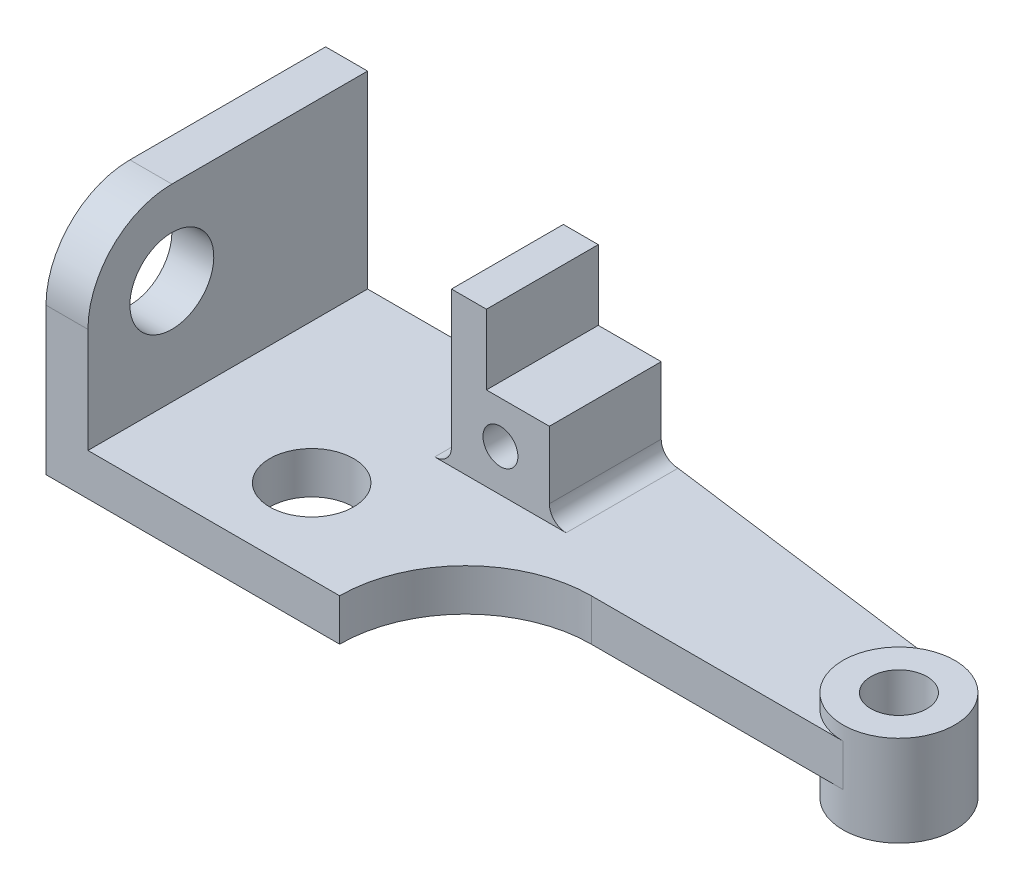
from build123d import *

# Parameters (mm, degrees)
SKETCH1_R               = 3.96875
BOSS_EXTRUDE1_DEPTH     = 9.525
BOSS_EXTRUDE4_START     = 9.525
BOSS_EXTRUDE4_OUTLINE_R = 3.96875
BOSS_EXTRUDE4_DEPTH     = 15.875
BOSS_EXTRUDE5_START     = 25.4
BOSS_EXTRUDE5_DEPTH     = 38.1
SKETCH4_R               = 9.525
CUT_EXTRUDE1_DEPTH      = 177.01216089
SKETCH2_R               = 9.525
SKETCH2_W               = 12.7
SKETCH2_H               = 28.575
CUT_EXTRUDE2_DEPTH      = 182.288051609
CUT_EXTRUDE3_DEPTH      = 3.175
CUT_EXTRUDE4_START      = -12.7
CUT_EXTRUDE4_DEPTH      = 7.9375


# Read off the part's stored shape, not the designer's step: Boss-Extrude4, Boss-Extrude5
with BuildPart() as part:
    # Sketch1 → Boss-Extrude1 (new body)
    with BuildSketch(Plane.XY):
        with BuildLine():
            Line((0, 0), (92.075, 0))
            ThreePointArc((92.075, 0), (96.565128061, -1.859871939), (98.425, -6.35))
            Line((98.425, -6.35), (98.425, -12.7))
            ThreePointArc((98.425, -12.7), (109.5375, -23.8125), (120.65, -12.7))
            Line((120.65, -12.7), (120.65, -6.35))
            ThreePointArc((120.65, -6.35), (122.509871939, -1.859871939), (127, 0))
            Line((127, 0), (139.7, 0))
            Line((139.7, 0), (139.7, -7.9375))
            Line((139.7, -7.9375), (165.1, -7.9375))
            Line((165.1, -7.9375), (165.1, 12.7))
            Line((165.1, 12.7), (139.7, 12.7))
            Line((139.7, 12.7), (139.7, 9.525))
            Line((139.7, 9.525), (80.01, 9.525))
            ThreePointArc((80.01, 9.525), (77.315923164, 10.640923164), (76.2, 13.335))
            Line((76.2, 13.335), (76.2, 28.575))
            Line((76.2, 28.575), (61.9125, 28.575))
            Line((61.9125, 28.575), (61.9125, 44.45))
            Line((61.9125, 44.45), (53.975, 44.45))
            Line((53.975, 44.45), (53.975, 13.335))
            ThreePointArc((53.975, 13.335), (52.859076836, 10.640923164), (50.165, 9.525))
            Line((50.165, 9.525), (9.525, 9.525))
            Line((9.525, 9.525), (9.525, 52.3875))
            Line((9.525, 52.3875), (0, 52.3875))
            Line((0, 52.3875), (0, 0))
        make_face()
        with Locations(Location((109.5375, -12.7, 0), (0, 0, 180))):
            Circle(SKETCH1_R, mode=Mode.SUBTRACT)
        with Locations(Location((65.0875, 19.05, 0), (0, 0, 180))):
            Circle(SKETCH1_R, mode=Mode.SUBTRACT)
    extrude(amount=BOSS_EXTRUDE1_DEPTH)

    # Boss-Extrude4 outline → Boss-Extrude4 (add)
    with BuildSketch(Plane.XY.offset(BOSS_EXTRUDE4_START)):
        with BuildLine():
            Line((9.525, 52.3875), (0, 52.3875))
            Line((0, 52.3875), (0, 0))
            Line((0, 0), (139.7, 0))
            Line((139.7, 0), (139.7, -7.9375))
            Line((139.7, -7.9375), (165.1, -7.9375))
            Line((165.1, -7.9375), (165.1, 12.7))
            Line((165.1, 12.7), (139.7, 12.7))
            Line((139.7, 12.7), (139.7, 9.525))
            Line((139.7, 9.525), (80.01, 9.525))
            ThreePointArc((80.01, 9.525), (77.315923164, 10.640923164), (76.2, 13.335))
            Line((76.2, 13.335), (76.2, 28.575))
            Line((76.2, 28.575), (61.9125, 28.575))
            Line((61.9125, 28.575), (61.9125, 44.45))
            Line((61.9125, 44.45), (53.975, 44.45))
            Line((53.975, 44.45), (53.975, 13.335))
            ThreePointArc((53.975, 13.335), (52.859076836, 10.640923164), (50.165, 9.525))
            Line((50.165, 9.525), (9.525, 9.525))
            Line((9.525, 9.525), (9.525, 52.3875))
        make_face()
        with Locations((65.0875, 19.05)):
            Circle(BOSS_EXTRUDE4_OUTLINE_R, mode=Mode.SUBTRACT)
    extrude(amount=BOSS_EXTRUDE4_DEPTH)

    # Boss-Extrude5 outline → Boss-Extrude5 (add)
    with BuildSketch(Plane.XY.offset(BOSS_EXTRUDE5_START)):
        Polygon((9.525, 52.3875), (0, 52.3875), (0, 0), (139.7, 0), (139.7, -7.9375), (165.1, -7.9375), (165.1, 12.7), (139.7, 12.7), (139.7, 9.525), (9.525, 9.525), align=None)
    extrude(amount=BOSS_EXTRUDE5_DEPTH)

    # Sketch4 → Cut-Extrude1 (cut, through all)
    with BuildSketch(Plane(origin=(9.525, 0, 0), x_dir=(0, 0, -1), z_dir=(1, 0, 0))):
        with BuildLine():
            Line((-63.5, 52.3875), (-63.5, 33.3375))
            ThreePointArc((-63.5, 33.3375), (-57.920384182, 46.807884182), (-44.45, 52.3875))
            Line((-44.45, 52.3875), (-63.5, 52.3875))
        make_face()
        with Locations(Location((-44.45, 33.3375, 0), (0, 0, 90))):
            Circle(SKETCH4_R)
    extrude(amount=-CUT_EXTRUDE1_DEPTH, mode=Mode.SUBTRACT)

    # Sketch2 → Cut-Extrude2 (cut, through all)
    with BuildSketch(Plane(origin=(0, 12.7, 0), x_dir=(1, 0, 0), z_dir=(0, 1, 0))):
        with Locations(Location((41.275, -44.45, 0), (0, 0, 180))):
            Circle(SKETCH2_R)
        with BuildLine():
            ThreePointArc((123.825, -63.5), (115.455576272, -43.294423728), (95.25, -34.925))
            ThreePointArc((95.25, -34.925), (75.044423728, -43.294423728), (66.675, -63.5))
            Line((66.675, -63.5), (123.825, -63.5))
        make_face()
        with BuildLine():
            ThreePointArc((66.675, -63.5), (95.25, -92.075), (123.825, -63.5))
            Line((123.825, -63.5), (66.675, -63.5))
        make_face()
        with BuildLine():
            Line((139.7, -63.5), (139.7, -34.925))
            Line((139.7, -34.925), (95.25, -34.925))
            ThreePointArc((95.25, -34.925), (115.455576272, -43.294423728), (123.825, -63.5))
            Line((123.825, -63.5), (139.7, -63.5))
        make_face()
        with BuildLine():
            Line((165.1, -63.5), (165.1, -22.225))
            ThreePointArc((165.1, -22.225), (161.380256121, -31.205256121), (152.4, -34.925))
            Line((152.4, -34.925), (152.4, -63.5))
            Line((152.4, -63.5), (165.1, -63.5))
        make_face()
        with Locations((146.05, -49.2125)):
            Rectangle(SKETCH2_W, SKETCH2_H)
        with BuildLine():
            Line((165.1, 0), (152.4, 0))
            Line((152.4, 0), (152.4, -9.525))
            ThreePointArc((152.4, -9.525), (161.380256121, -13.244743879), (165.1, -22.225))
            Line((165.1, -22.225), (165.1, 0))
        make_face()
        Polygon((152.4, -9.525), (152.4, 0), (139.7, 0), (139.7, -7.853947368), align=None)
        Polygon((139.7, -7.853947368), (139.7, 0), (80.01, 0), align=None)
        with BuildLine():
            ThreePointArc((158.75, -22.225), (156.890128061, -17.734871939), (152.4, -15.875))
            Line((152.4, -15.875), (152.4, -28.575))
            ThreePointArc((152.4, -28.575), (156.890128061, -26.715128061), (158.75, -22.225))
        make_face()
        with BuildLine():
            Line((152.4, -28.575), (152.4, -15.875))
            ThreePointArc((152.4, -15.875), (146.05, -22.225), (152.4, -28.575))
        make_face()
    extrude(amount=-CUT_EXTRUDE2_DEPTH, mode=Mode.SUBTRACT)

    # Sketch2<3> → Cut-Extrude3 (cut)
    with BuildSketch(Plane(origin=(0, 12.7, 0), x_dir=(1, 0, 0), z_dir=(0, 1, 0))):
        with BuildLine():
            ThreePointArc((152.4, -34.925), (143.419743879, -31.205256121), (139.7, -22.225))
            Line((139.7, -22.225), (139.7, -34.925))
            Line((139.7, -34.925), (152.4, -34.925))
        make_face()
        with BuildLine():
            ThreePointArc((139.7, -22.225), (143.419743879, -13.244743879), (152.4, -9.525))
            Line((152.4, -9.525), (139.7, -7.853947368))
            Line((139.7, -7.853947368), (139.7, -22.225))
        make_face()
    extrude(amount=-CUT_EXTRUDE3_DEPTH, mode=Mode.SUBTRACT)

    # Sketch2<5> → Cut-Extrude4 (cut)
    with BuildSketch(Plane(origin=(0, 12.7, 0), x_dir=(1, 0, 0), z_dir=(0, 1, 0)).offset(CUT_EXTRUDE4_START)):
        with BuildLine():
            ThreePointArc((139.7, -22.225), (143.419743879, -13.244743879), (152.4, -9.525))
            Line((152.4, -9.525), (139.7, -7.853947368))
            Line((139.7, -7.853947368), (139.7, -22.225))
        make_face()
        with BuildLine():
            ThreePointArc((152.4, -34.925), (143.419743879, -31.205256121), (139.7, -22.225))
            Line((139.7, -22.225), (139.7, -34.925))
            Line((139.7, -34.925), (152.4, -34.925))
        make_face()
    extrude(amount=-CUT_EXTRUDE4_DEPTH, mode=Mode.SUBTRACT)


solid = part.part
